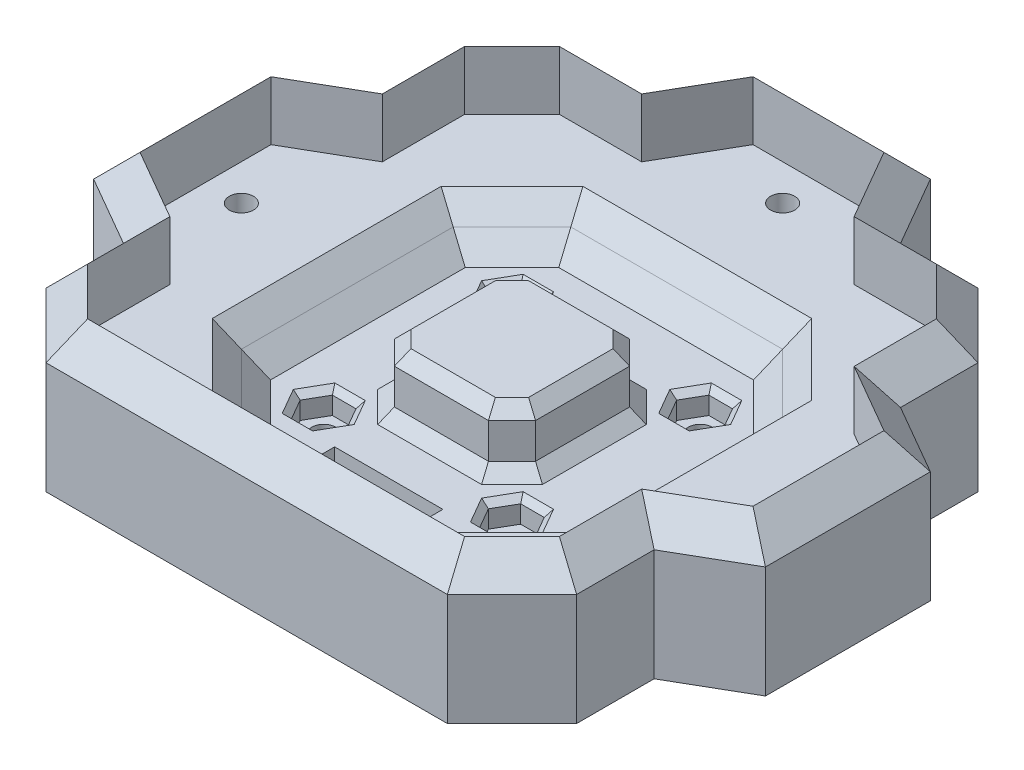
from build123d import *

# Parameters (mm, degrees)
OUTER_WALLS_EXTRUDE_DEPTH            = 10
BASE_EXTRUDE_DEPTH                   = 14
RACK_CUT_DEPTH                       = 82.956207819
WALLS_OUTER_CHAMFER_SIZE             = 5
SPACER_CUTOUT_DEPTH                  = 7
SPACER_CHAMFER_SIZE                  = 3.5
BUMPER_EXTRUDE_DEPTH                 = 10
BUMPER_CHAMFER_SIZE                  = 2
SKETCH5_R                            = 2.05
TRACK_MOUNT_HOLES_DEPTH              = 82.956207819
SKETCH10_R                           = 3.5
TRACK_MOUNT_COUNTERSINK_DEPTH        = 3
TRACK_MOUNT_COUNTERSINK_CHAMFER_SIZE = 1.5
SKETCH7_R                            = 2.05
FLOOR_MOUNT_HOLES_DEPTH              = 83.521633527
FLOOR_MOUNT_NUT_INSET_DEPTH          = 4
FLOOR_MOUNT_NUT_CHAMFER_SIZE         = 1


# Some blends are built 0.0001 mm under size
with BuildPart() as part:
    # Sketch2 → Outer Walls Extrude (new body)
    with BuildSketch(Plane(origin=(0, 0, 0), x_dir=(1, 0, 0), z_dir=(0, 1, 0))):
        Polygon((-5, -45.1), (5, -45.1), (34.112489168, -45.1), (45.1, -34.112489168), (45.1, -20.944486373), (57.1, -14.016283143), (57.1, 14.016283143), (45.1, 20.944486373), (45.1, 34.112489168), (34.112489168, 45.1), (20.944486373, 45.1), (14.016283143, 57.1), (-14.016283143, 57.1), (-20.944486373, 45.1), (-34.112489168, 45.1), (-45.1, 34.112489168), (-45.1, 20.944486373), (-57.1, 14.016283143), (-57.1, -14.016283143), (-45.1, -20.944486373), (-45.1, -34.112489168), (-34.112489168, -45.1), align=None)
        Polygon((-5, -40.1), (5, -40.1), (32.041421356, -40.1), (40.1, -32.041421356), (40.1, -18.057735027), (52.1, -11.129531797), (52.1, 11.129531797), (40.1, 18.057735027), (40.1, 32.041421356), (32.041421356, 40.1), (18.057735027, 40.1), (11.129531797, 52.1), (-11.129531797, 52.1), (-18.057735027, 40.1), (-32.041421356, 40.1), (-40.1, 32.041421356), (-40.1, 18.057735027), (-52.1, 11.129531797), (-52.1, -11.129531797), (-40.1, -18.057735027), (-40.1, -32.041421356), (-32.041421356, -40.1), align=None, mode=Mode.SUBTRACT)
    extrude(amount=OUTER_WALLS_EXTRUDE_DEPTH)

    # Sketch3 → Base Extrude (add)
    with BuildSketch(Plane.XZ):
        Polygon((34.112489168, 45.1), (-34.112489168, 45.1), (-45.1, 34.112489168), (-45.1, 20.944486373), (-57.1, 14.016283143), (-57.1, -14.016283143), (-45.1, -20.944486373), (-45.1, -34.112489168), (-34.112489168, -45.1), (-20.944486373, -45.1), (-14.016283143, -57.1), (14.016283143, -57.1), (20.944486373, -45.1), (34.112489168, -45.1), (45.1, -34.112489168), (45.1, -20.944486373), (57.1, -14.016283143), (57.1, 14.016283143), (45.1, 20.944486373), (45.1, 34.112489168), align=None)
    extrude(amount=BASE_EXTRUDE_DEPTH)

    # Sketch11 → Rack Cut (cut, through all)
    with BuildSketch(Plane(origin=(0, 0, 0), x_dir=(1, 0, 0), z_dir=(0, 1, 0))):
        Polygon((-5.2, -40), (-5.2, -40.1), (5.2, -40.1), (5.2, -40), (5.2, -27.732842712), (9.2, -23.732842712), (9.2, -20.95), (-9.2, -20.95), (-9.2, -23.732842712), (-5.2, -27.732842712), align=None)
    extrude(amount=-RACK_CUT_DEPTH, mode=Mode.SUBTRACT)

    # Walls Outer Chamfer
    walls_outer_chamfer_edges = [part.edges().sort_by_distance(p)[0] for p in [
        (39.606244584, 10, 39.606244584),
        (45.1, 10, 27.52848777),
        (51.1, 10, 17.480384758),
        (57.1, 10, 0),
        (51.1, 10, -17.480384758),
        (45.1, 10, -27.52848777),
        (39.606244584, 10, -39.606244584),
        (27.52848777, 10, -45.1),
        (17.480384758, 10, -51.1),
        (0, 10, 45.1),
        (0, 10, -57.1),
        (-17.480384758, 10, -51.1),
        (-27.52848777, 10, -45.1),
        (-39.606244584, 10, -39.606244584),
        (-45.1, 10, -27.52848777),
        (-51.1, 10, -17.480384758),
        (-57.1, 10, 0),
        (-51.1, 10, 17.480384758),
        (-45.1, 10, 27.52848777),
        (-39.606244584, 10, 39.606244584),
    ]]
    chamfer(walls_outer_chamfer_edges, length=WALLS_OUTER_CHAMFER_SIZE - 0.0001)  # a hair under: the kernel refuses the full size

    # Sketch6 → Spacer Cutout (cut)
    with BuildSketch(Plane(origin=(0, 0, 0), x_dir=(1, 0, 0), z_dir=(0, 1, 0))):
        Polygon((18, -28), (-18, -28), (-28, -18), (-28, 18), (-18, 28), (18, 28), (28, 18), (28, -18), align=None)
    extrude(amount=-SPACER_CUTOUT_DEPTH, mode=Mode.SUBTRACT)

    # Spacer Chamfer
    spacer_chamfer_edges = [part.edges().sort_by_distance(p)[0] for p in [
        (11.6, -7, 28),
        (23, -7, 23),
        (28, -7, 0),
        (23, -7, -23),
        (0, -7, -28),
        (-11.6, -7, 28),
        (-23, -7, 23),
        (-28, -7, 0),
        (-23, -7, -23),
        (28, 0, 0),
        (23, 0, -23),
        (0, 0, -28),
        (23, 0, 23),
        (11.6, 0, 28),
        (-11.6, 0, 28),
        (-23, 0, 23),
        (-28, 0, 0),
        (-23, 0, -23),
    ]]
    chamfer(spacer_chamfer_edges, length=SPACER_CHAMFER_SIZE - 0.0001)  # a hair under: the kernel refuses the full size

    # Sketch12 → Bumper Extrude (add)
    with BuildSketch(Plane(origin=(0, -7, 0), x_dir=(1, 0, 0), z_dir=(0, 1, 0))):
        Polygon((-12, 8), (-8, 12), (8, 12), (12, 8), (12, -8), (8, -12), (-8, -12), (-12, -8), align=None)
    extrude(amount=BUMPER_EXTRUDE_DEPTH)

    # Bumper Chamfer
    bumper_chamfer_edges = [part.edges().sort_by_distance(p)[0] for p in [
        (-12, -7, 0),
        (-10, -7, 10),
        (0, -7, 12),
        (10, -7, 10),
        (12, -7, 0),
        (10, -7, -10),
        (0, -7, -12),
        (-10, -7, -10),
        (-12, 3, 0),
        (-10, 3, 10),
        (0, 3, 12),
        (10, 3, 10),
        (12, 3, 0),
        (10, 3, -10),
        (0, 3, -12),
        (-10, 3, -10),
    ]]
    chamfer(bumper_chamfer_edges, length=BUMPER_CHAMFER_SIZE)

    # Sketch5 → Track Mount Holes (cut, through all)
    with BuildSketch(Plane(origin=(0, 0, 0), x_dir=(1, 0, 0), z_dir=(0, 1, 0))):
        with Locations(Location((46, 0, 0), (0, 0, 270))):
            Circle(SKETCH5_R)
        with Locations(Location((0, 46, 0), (0, 0, 270))):
            Circle(SKETCH5_R)
        with Locations(Location((-46, 0, 0), (0, 0, 270))):
            Circle(SKETCH5_R)
    extrude(amount=-TRACK_MOUNT_HOLES_DEPTH, mode=Mode.SUBTRACT)

    # Sketch10 → Track Mount Countersink (cut)
    with BuildSketch(Plane.XZ.offset(14)):
        with Locations(Location((-46, 0, 0), (0, 0, 270))):
            Circle(SKETCH10_R)
        with Locations(Location((0, -46, 0), (0, 0, 270))):
            Circle(SKETCH10_R)
        with Locations(Location((46, 0, 0), (0, 0, 270))):
            Circle(SKETCH10_R)
    extrude(amount=-TRACK_MOUNT_COUNTERSINK_DEPTH, mode=Mode.SUBTRACT)

    # Track Mount Countersink Chamfer
    # the kernel refuses this chamfer: 1.5 mm, written as the material it takes off along each edge
    with BuildSketch(Plane(origin=(46, -14, 0), x_dir=(0, 0, -1), z_dir=(-1, 0, 0))) as track_mount_countersink_chamfer_piece_1:
        Polygon((3.5 + TRACK_MOUNT_COUNTERSINK_CHAMFER_SIZE, 0), (3.5, -TRACK_MOUNT_COUNTERSINK_CHAMFER_SIZE), (3.5, 0), align=None)
    revolve(axis=Axis((46, -14, 0), (0, -1, 0)), mode=Mode.SUBTRACT)
    with BuildSketch(Plane(origin=(0, -14, -46), x_dir=(0, 0, -1), z_dir=(-1, 0, 0))) as track_mount_countersink_chamfer_piece_2:
        Polygon((3.5 + TRACK_MOUNT_COUNTERSINK_CHAMFER_SIZE, 0), (3.5, -TRACK_MOUNT_COUNTERSINK_CHAMFER_SIZE), (3.5, 0), align=None)
    revolve(axis=Axis((0, -14, -46), (0, -1, 0)), mode=Mode.SUBTRACT)
    with BuildSketch(Plane(origin=(-46, -14, 0), x_dir=(0, 0, -1), z_dir=(-1, 0, 0))) as track_mount_countersink_chamfer_piece_3:
        Polygon((3.5 + TRACK_MOUNT_COUNTERSINK_CHAMFER_SIZE, 0), (3.5, -TRACK_MOUNT_COUNTERSINK_CHAMFER_SIZE), (3.5, 0), align=None)
    revolve(axis=Axis((-46, -14, 0), (0, -1, 0)), mode=Mode.SUBTRACT)
    with BuildSketch(Plane(origin=(46, -11, 0), x_dir=(0, 0, 1), z_dir=(-1, 0, 0))) as track_mount_countersink_chamfer_piece_4_section:
        Polygon((2.05, TRACK_MOUNT_COUNTERSINK_CHAMFER_SIZE), (2.05 + TRACK_MOUNT_COUNTERSINK_CHAMFER_SIZE, 0), (2.05, 0), align=None)
    track_mount_countersink_chamfer_piece_4 = revolve(axis=Axis((46, -11, 0), (0, 1, 0)), mode=Mode.PRIVATE)
    track_mount_countersink_chamfer_piece_4 = track_mount_countersink_chamfer_piece_4 & Plane(origin=(46, -10.222866451, 0), x_dir=(0, 0, -1), z_dir=(0, -1, 0)) * Cylinder(3.5, 15, mode=Mode.PRIVATE)
    add(track_mount_countersink_chamfer_piece_4, mode=Mode.SUBTRACT)
    with BuildSketch(Plane(origin=(0, -11, -46), x_dir=(0, 0, 1), z_dir=(-1, 0, 0))) as track_mount_countersink_chamfer_piece_5_section:
        Polygon((2.05, TRACK_MOUNT_COUNTERSINK_CHAMFER_SIZE), (2.05 + TRACK_MOUNT_COUNTERSINK_CHAMFER_SIZE, 0), (2.05, 0), align=None)
    track_mount_countersink_chamfer_piece_5 = revolve(axis=Axis((0, -11, -46), (0, 1, 0)), mode=Mode.PRIVATE)
    track_mount_countersink_chamfer_piece_5 = track_mount_countersink_chamfer_piece_5 & Plane(origin=(0, -10.222866451, -46), x_dir=(0, 0, -1), z_dir=(0, -1, 0)) * Cylinder(3.5, 15, mode=Mode.PRIVATE)
    add(track_mount_countersink_chamfer_piece_5, mode=Mode.SUBTRACT)
    with BuildSketch(Plane(origin=(-46, -11, 0), x_dir=(0, 0, 1), z_dir=(-1, 0, 0))) as track_mount_countersink_chamfer_piece_6_section:
        Polygon((2.05, TRACK_MOUNT_COUNTERSINK_CHAMFER_SIZE), (2.05 + TRACK_MOUNT_COUNTERSINK_CHAMFER_SIZE, 0), (2.05, 0), align=None)
    track_mount_countersink_chamfer_piece_6 = revolve(axis=Axis((-46, -11, 0), (0, 1, 0)), mode=Mode.PRIVATE)
    track_mount_countersink_chamfer_piece_6 = track_mount_countersink_chamfer_piece_6 & Plane(origin=(-46, -10.222866451, 0), x_dir=(0, 0, -1), z_dir=(0, -1, 0)) * Cylinder(3.5, 15, mode=Mode.PRIVATE)
    add(track_mount_countersink_chamfer_piece_6, mode=Mode.SUBTRACT)

    # Sketch7 → Floor Mount Holes (cut, through all)
    with BuildSketch(Plane(origin=(0, -7, 0), x_dir=(1, 0, 0), z_dir=(0, 1, 0))):
        with Locations(Location((-16, 16, 0), (0, 0, 270))):
            Circle(SKETCH7_R)
        with Locations(Location((16, 16, 0), (0, 0, 270))):
            Circle(SKETCH7_R)
        with Locations(Location((16, -16, 0), (0, 0, 270))):
            Circle(SKETCH7_R)
        with Locations(Location((-16, -16, 0), (0, 0, 270))):
            Circle(SKETCH7_R)
    extrude(amount=-FLOOR_MOUNT_HOLES_DEPTH, mode=Mode.SUBTRACT)

    # Sketch9 → Floor Mount Nut Inset (cut)
    with BuildSketch(Plane(origin=(0, -7, 0), x_dir=(1, 0, 0), z_dir=(0, 1, 0))):
        Polygon((-11.987415629, 16), (-13.993707815, 19.475), (-18.006292185, 19.475), (-20.012584371, 16), (-18.006292185, 12.525), (-13.993707815, 12.525), align=None)
        Polygon((11.987415629, 16), (13.993707815, 12.525), (18.006292185, 12.525), (20.012584371, 16), (18.006292185, 19.475), (13.993707815, 19.475), align=None)
        Polygon((-11.987415629, -16), (-13.993707815, -12.525), (-18.006292185, -12.525), (-20.012584371, -16), (-18.006292185, -19.475), (-13.993707815, -19.475), align=None)
        Polygon((11.987415629, -16), (13.993707815, -19.475), (18.006292185, -19.475), (20.012584371, -16), (18.006292185, -12.525), (13.993707815, -12.525), align=None)
    extrude(amount=-FLOOR_MOUNT_NUT_INSET_DEPTH, mode=Mode.SUBTRACT)

    # Floor Mount Nut Chamfer
    floor_mount_nut_chamfer_edges = [part.edges().sort_by_distance(p)[0] for p in [
        (12.990561722, -7, -17.7375),
        (12.990561722, -7, -14.2625),
        (16, -7, -12.525),
        (19.009438278, -7, -14.2625),
        (19.009438278, -7, -17.7375),
        (16, -7, -19.475),
        (-12.990561722, -7, 17.7375),
        (-12.990561722, -7, 14.2625),
        (-16, -7, 12.525),
        (-19.009438278, -7, 14.2625),
        (-19.009438278, -7, 17.7375),
        (-16, -7, 19.475),
        (12.990561722, -7, 14.2625),
        (12.990561722, -7, 17.7375),
        (16, -7, 19.475),
        (19.009438278, -7, 17.7375),
        (19.009438278, -7, 14.2625),
        (16, -7, 12.525),
        (-12.990561722, -7, -14.2625),
        (-12.990561722, -7, -17.7375),
        (-16, -7, -19.475),
        (-19.009438278, -7, -17.7375),
        (-19.009438278, -7, -14.2625),
        (-16, -7, -12.525),
    ]]
    chamfer(floor_mount_nut_chamfer_edges, length=FLOOR_MOUNT_NUT_CHAMFER_SIZE)


solid = part.part
